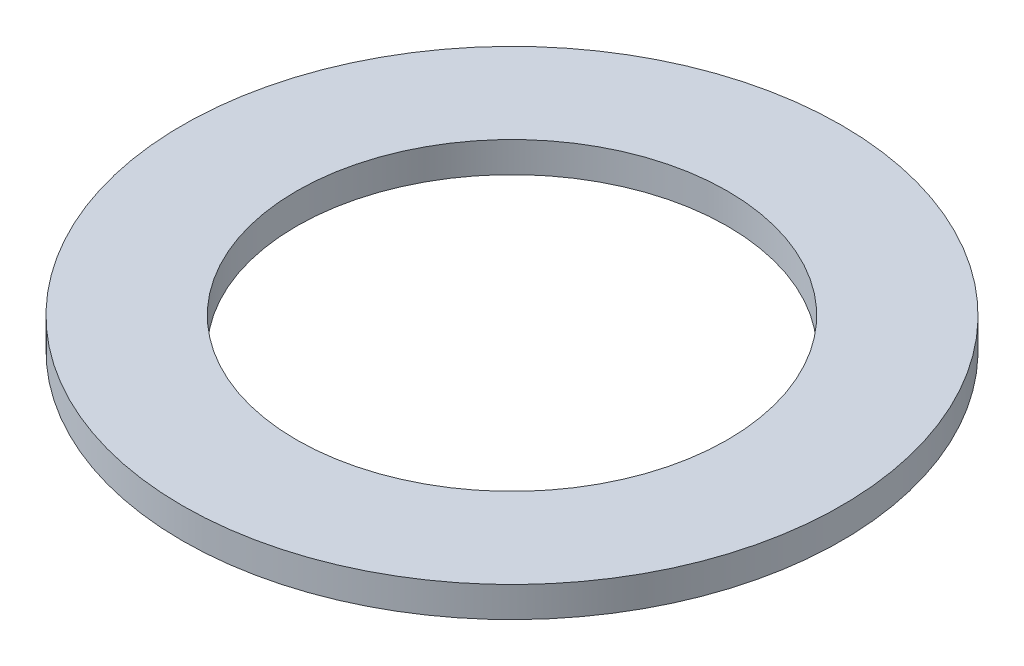
from build123d import *

# Parameters (mm, degrees)
SKETCH1_R           = 65
BOSS_EXTRUDE1_DEPTH = 6
SKETCH2_R           = 42.5
CUT_EXTRUDE1_DEPTH  = 93.119487623


with BuildPart() as part:
    # Sketch1 → Boss-Extrude1 (new body)
    with BuildSketch(Plane(origin=(0, 0, 0), x_dir=(1, 0, 0), z_dir=(0, 1, 0))):
        Circle(SKETCH1_R)
    extrude(amount=BOSS_EXTRUDE1_DEPTH)

    # Sketch2 → Cut-Extrude1 (cut, through all)
    with BuildSketch(Plane(origin=(0, 0, 0), x_dir=(1, 0, 0), z_dir=(0, 1, 0))):
        Circle(SKETCH2_R)
    extrude(amount=CUT_EXTRUDE1_DEPTH, mode=Mode.SUBTRACT)


solid = part.part
